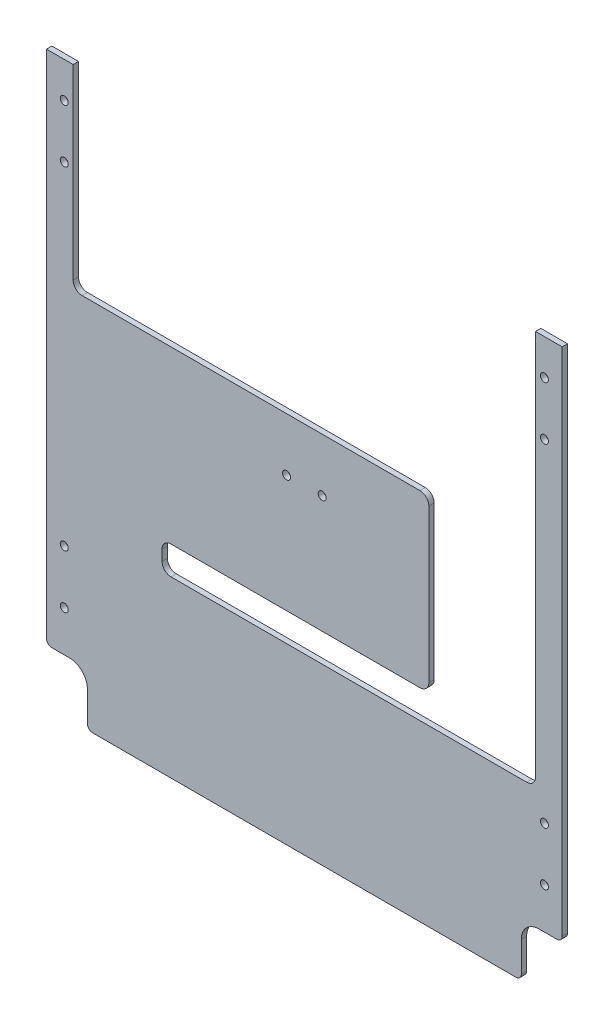
from build123d import *

# Parameters (mm, degrees)
ESQUISSE1_W                  = 290
ESQUISSE1_H                  = 320
BOSS_EXTRU_1_DEPTH           = 3
ENL_V_MAT_EXTRU_1_DEPTH      = 432.866877637
ENL_V_MAT_EXTRU_1_DEPTH_BACK = 432.866877637
ESQUISSE2_W                  = 23
ESQUISSE2_H                  = 30
CONG_1_R                     = 10
CONG_2_R                     = 3
ENL_V_MAT_EXTRU_2_DEPTH      = 432.866877637
ENL_V_MAT_EXTRU_2_DEPTH_BACK = 432.866877637
ESQUISSE3_W                  = 140
ESQUISSE3_H                  = 110
ENL_V_MAT_EXTRU_3_DEPTH      = 432.866877637
ENL_V_MAT_EXTRU_3_DEPTH_BACK = 432.866877637
ESQUISSE4_W                  = 60
ESQUISSE4_H                  = 222
ENL_V_MAT_EXTRU_4_DEPTH      = 432.866877637
ENL_V_MAT_EXTRU_4_DEPTH_BACK = 432.866877637
ESQUISSE5_W                  = 60
ESQUISSE5_H                  = 110
ENL_V_MAT_EXTRU_5_DEPTH      = 432.866877637
ENL_V_MAT_EXTRU_5_DEPTH_BACK = 432.866877637
ESQUISSE6_W                  = 150
ESQUISSE6_H                  = 16
CONG_3_R                     = 5
ENL_V_MAT_EXTRU_6_DEPTH      = 432.866877637
ENL_V_MAT_EXTRU_6_DEPTH_BACK = 432.866877637
ESQUISSE7_R                  = 2.25
ENL_V_MAT_EXTRU_7_DEPTH      = 432.866877637
ENL_V_MAT_EXTRU_7_DEPTH_BACK = 432.866877637
ESQUISSE8_R                  = 2.25


with BuildPart() as part:
    # Esquisse1 → Boss.-Extru.1 (new body)
    with BuildSketch(Plane.XY):
        with Locations((145, 160)):
            Rectangle(ESQUISSE1_W, ESQUISSE1_H)
    extrude(amount=BOSS_EXTRU_1_DEPTH)

    # Esquisse2 → Enlèv. mat.-Extru.1 (cut, two sides: drawn at the far end of the back side and taken through both)
    with BuildSketch(Plane.XY.offset(3).offset(-ENL_V_MAT_EXTRU_1_DEPTH_BACK)):
        with Locations((278.5, 15)):
            Rectangle(ESQUISSE2_W, ESQUISSE2_H)
        with Locations((11.5, 15)):
            Rectangle(ESQUISSE2_W, ESQUISSE2_H)
    extrude(amount=ENL_V_MAT_EXTRU_1_DEPTH + ENL_V_MAT_EXTRU_1_DEPTH_BACK, mode=Mode.SUBTRACT)

    # Congé1
    cong_1_edges = [part.edges().sort_by_distance(p)[0] for p in [
        (267, 30, 1.5),
        (23, 30, 1.5),
    ]]
    fillet(cong_1_edges, radius=CONG_1_R)

    # Congé2
    cong_2_edges = [part.edges().sort_by_distance(p)[0] for p in [
        (290, 30, 1.5),
        (0, 30, 1.5),
        (23, 0, 1.5),
        (267, 0, 1.5),
    ]]
    fillet(cong_2_edges, radius=CONG_2_R)

    # Esquisse3 → Enlèv. mat.-Extru.2 (cut, two sides: drawn at the far end of the back side and taken through both)
    with BuildSketch(Plane.XY.offset(3).offset(-ENL_V_MAT_EXTRU_2_DEPTH_BACK)):
        with Locations((145, 265)):
            Rectangle(ESQUISSE3_W, ESQUISSE3_H)
    extrude(amount=ENL_V_MAT_EXTRU_2_DEPTH + ENL_V_MAT_EXTRU_2_DEPTH_BACK, mode=Mode.SUBTRACT)

    # Esquisse4 → Enlèv. mat.-Extru.3 (cut, two sides: drawn at the far end of the back side and taken through both)
    with BuildSketch(Plane.XY.offset(3).offset(-ENL_V_MAT_EXTRU_3_DEPTH_BACK)):
        with Locations((245, 209)):
            Rectangle(ESQUISSE4_W, ESQUISSE4_H)
    extrude(amount=ENL_V_MAT_EXTRU_3_DEPTH + ENL_V_MAT_EXTRU_3_DEPTH_BACK, mode=Mode.SUBTRACT)

    # Esquisse5 → Enlèv. mat.-Extru.4 (cut, two sides: drawn at the far end of the back side and taken through both)
    with BuildSketch(Plane.XY.offset(3).offset(-ENL_V_MAT_EXTRU_4_DEPTH_BACK)):
        with Locations((45, 265)):
            Rectangle(ESQUISSE5_W, ESQUISSE5_H)
    extrude(amount=ENL_V_MAT_EXTRU_4_DEPTH + ENL_V_MAT_EXTRU_4_DEPTH_BACK, mode=Mode.SUBTRACT)

    # Esquisse6 → Enlèv. mat.-Extru.5 (cut, two sides: drawn at the far end of the back side and taken through both)
    with BuildSketch(Plane.XY.offset(3).offset(-ENL_V_MAT_EXTRU_5_DEPTH_BACK)):
        with Locations((140, 106)):
            Rectangle(ESQUISSE6_W, ESQUISSE6_H)
    extrude(amount=ENL_V_MAT_EXTRU_5_DEPTH + ENL_V_MAT_EXTRU_5_DEPTH_BACK, mode=Mode.SUBTRACT)

    # Congé3
    cong_3_edges = [part.edges().sort_by_distance(p)[0] for p in [
        (275, 98, 1.5),
        (65, 98, 1.5),
        (65, 114, 1.5),
        (215, 114, 1.5),
        (215, 210, 1.5),
        (15, 210, 1.5),
    ]]
    fillet(cong_3_edges, radius=CONG_3_R)

    # Esquisse7 → Enlèv. mat.-Extru.6 (cut, two sides: drawn at the far end of the back side and taken through both)
    with BuildSketch(Plane.XY.offset(3).offset(-ENL_V_MAT_EXTRU_6_DEPTH_BACK)):
        with Locations((280, 300)):
            Circle(ESQUISSE7_R)
        with Locations((280, 270)):
            Circle(ESQUISSE7_R)
        with Locations((10, 270)):
            Circle(ESQUISSE7_R)
        with Locations((10, 300)):
            Circle(ESQUISSE7_R)
        with Locations((280, 83)):
            Circle(ESQUISSE7_R)
        with Locations((280, 53)):
            Circle(ESQUISSE7_R)
        with Locations((10, 53)):
            Circle(ESQUISSE7_R)
        with Locations((10, 83)):
            Circle(ESQUISSE7_R)
    extrude(amount=ENL_V_MAT_EXTRU_6_DEPTH + ENL_V_MAT_EXTRU_6_DEPTH_BACK, mode=Mode.SUBTRACT)

    # Esquisse8 → Enlèv. mat.-Extru.7 (cut, two sides: drawn at the far end of the back side and taken through both)
    with BuildSketch(Plane.XY.offset(3).offset(-ENL_V_MAT_EXTRU_7_DEPTH_BACK)):
        with Locations((135, 180)):
            Circle(ESQUISSE8_R)
        with Locations((155, 180)):
            Circle(ESQUISSE8_R)
    extrude(amount=ENL_V_MAT_EXTRU_7_DEPTH + ENL_V_MAT_EXTRU_7_DEPTH_BACK, mode=Mode.SUBTRACT)


solid = part.part
